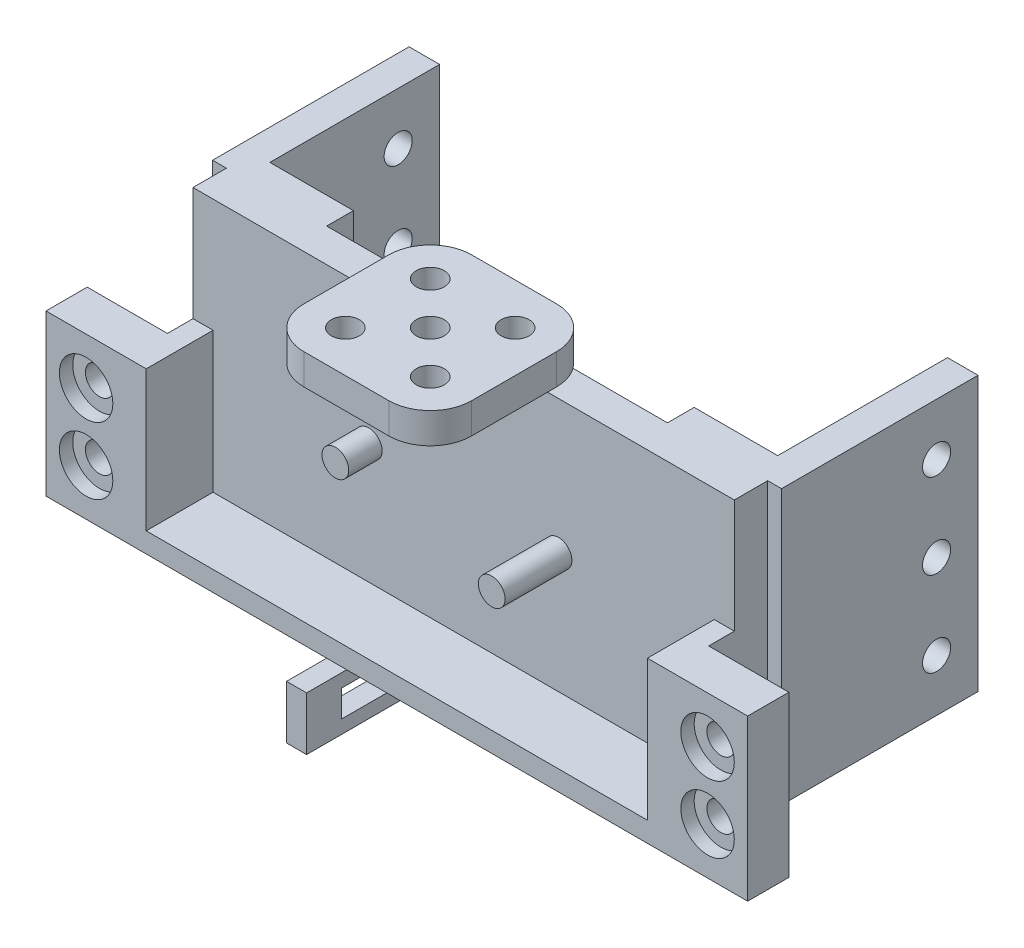
from build123d import *

# Parameters (mm, degrees)
SKETCH1_W                = 75
SKETCH1_H                = 35
BOSS_EXTRUDE1_DEPTH      = 5
SKETCH2_R                = 2
BOSS_EXTRUDE2_DEPTH      = 10
SKETCH3_W                = 75
SKETCH3_H                = 35
BOSS_EXTRUDE3_DEPTH      = 15
CUT_EXTRUDE2_DEPTH       = 10
SKETCH8_W                = 12.55
SKETCH8_H                = 5
SKETCH8_H_2              = 2.55
BOSS_EXTRUDE6_DEPTH      = 4.57
SKETCH9_R                = 2.1
CUT_EXTRUDE3_DEPTH       = 4.57
SKETCH14_W               = 3
SKETCH14_H               = 10
CUT_EXTRUDE5_DEPTH       = 17
SKETCH15_R               = 2.75
CUT_EXTRUDE6_DEPTH       = 1.5
FILLET1_R                = 1
CUT_EXTRUDE7_START       = -5
SKETCH19_R               = 2
CUT_EXTRUDE7_DEPTH       = 5
SKETCH20_W               = 6.17
SKETCH20_H               = 24
BOSS_EXTRUDE7_DEPTH      = 12
SKETCH21_W               = 6.17
SKETCH21_H               = 24
BOSS_EXTRUDE8_DEPTH      = 12
SKETCH24_R               = 2.1
CUT_EXTRUDE8_DEPTH       = 60.774520492
SKETCH25_R               = 4
CUT_EXTRUDE9_DEPTH       = 2
SKETCH26_W               = 3
SKETCH26_H               = 15
SKETCH26_H_2             = 6
BOSS_EXTRUDE9_DEPTH      = 8
SKETCH27_W               = 10.5
SKETCH27_H               = 4
CUT_EXTRUDE10_DEPTH      = 73.730684721
BOSS_EXTRUDE10_DEPTH     = 41
CUT_EXTRUDE11_DEPTH      = 100.332069343
CUT_EXTRUDE11_DEPTH_BACK = 100.332069343
SKETCH30_R               = 2.1
FILLET2_R                = 6.2


with BuildPart() as part:
    # Sketch1 → Boss-Extrude1 (new body)
    with BuildSketch(Plane.XY):
        Rectangle(SKETCH1_W, SKETCH1_H)
    extrude(amount=BOSS_EXTRUDE1_DEPTH)

    # Sketch2 → Boss-Extrude2 (add)
    with BuildSketch(Plane.XY.offset(5)):
        with Locations(Location((-14.2, 0.5, 0), (0, 0, 180))):
            Circle(SKETCH2_R)
        with Locations(Location((14.2, 0.5, 0), (0, 0, 180))):
            Circle(SKETCH2_R)
    extrude(amount=BOSS_EXTRUDE2_DEPTH)

    # Sketch3 → Boss-Extrude3 (add)
    with BuildSketch(Plane(origin=(0, 0, 0), x_dir=(-1, 0, 0), z_dir=(0, 0, -1))):
        Polygon((40.5, 20.5), (-37.5, 20.5), (-40.5, 20.5), (-40.5, -20.5), (40.5, -20.5), (40.5, -17.5), align=None)
        Rectangle(SKETCH3_W, SKETCH3_H, mode=Mode.SUBTRACT)
    extrude(amount=-BOSS_EXTRUDE3_DEPTH)

    # Sketch4 → Cut-Extrude2 (cut)
    with BuildSketch(Plane(origin=(0, 20.5, 0), x_dir=(1, 0, 0), z_dir=(0, 1, 0))):
        Polygon((-37.5, -5), (-37.5, -12.5), (-37.5, -14), (-37.5, -15), (37.5, -15), (37.5, -14), (37.5, -12.5), (37.5, -5), align=None)
    extrude(amount=-CUT_EXTRUDE2_DEPTH, mode=Mode.SUBTRACT)

    # Sketch8 → Boss-Extrude6 (add)
    with BuildSketch(Plane(origin=(0, 20.5, 0), x_dir=(1, 0, 0), z_dir=(0, 1, 0))):
        Polygon((0, -15), (0, -5), (-12.55, -5), (-12.55, -22.55), (0, -22.55), align=None)
        Polygon((12.55, -5), (0, -5), (0, -15), (0, -22.55), (12.55, -22.55), align=None)
        with Locations((-6.275, -2.5)):
            Rectangle(SKETCH8_W, SKETCH8_H)
        with Locations((-6.275, 1.275)):
            Rectangle(SKETCH8_W, SKETCH8_H_2)
        with Locations((6.275, 1.275)):
            Rectangle(SKETCH8_W, SKETCH8_H_2)
        with Locations((6.275, -2.5)):
            Rectangle(SKETCH8_W, SKETCH8_H)
    extrude(amount=BOSS_EXTRUDE6_DEPTH)

    # Sketch9 → Cut-Extrude3 (cut)
    with BuildSketch(Plane(origin=(0, 25.07, 0), x_dir=(1, 0, 0), z_dir=(0, 1, 0))):
        with Locations(Location((0, -10, 0), (0, 0, 270))):
            Circle(SKETCH9_R)
        with Locations(Location((-6.349818895, -3.650181105, 0), (0, 0, 270))):
            Circle(SKETCH9_R)
        with Locations(Location((6.349818895, -3.650181105, 0), (0, 0, 270))):
            Circle(SKETCH9_R)
        with Locations(Location((6.349818895, -16.349818895, 0), (0, 0, 270))):
            Circle(SKETCH9_R)
        with Locations(Location((-6.349818895, -16.349818895, 0), (0, 0, 270))):
            Circle(SKETCH9_R)
    extrude(amount=-CUT_EXTRUDE3_DEPTH, mode=Mode.SUBTRACT)

    # Sketch14 → Cut-Extrude5 (cut)
    with BuildSketch(Plane(origin=(0, 20.5, 0), x_dir=(1, 0, 0), z_dir=(0, 1, 0))):
        with Locations((-39, -10)):
            Rectangle(SKETCH14_W, SKETCH14_H)
        with Locations((39, -10)):
            Rectangle(SKETCH14_W, SKETCH14_H)
    extrude(amount=-CUT_EXTRUDE5_DEPTH, mode=Mode.SUBTRACT)

    # Sketch15 → Cut-Extrude6 (cut)
    with BuildSketch(Plane(origin=(0, 20.5, 0), x_dir=(1, 0, 0), z_dir=(0, 1, 0))):
        with Locations((-6.349818895, -3.650181105)):
            Circle(SKETCH15_R)
        with Locations((6.349818895, -3.650181105)):
            Circle(SKETCH15_R)
    extrude(amount=-CUT_EXTRUDE6_DEPTH, mode=Mode.SUBTRACT)

    # Fillet1
    fillet1_edges = [part.edges().sort_by_distance(p)[0] for p in [
        (-8.745750645, 19.75, 5),
        (-3.953887145, 19.75, 5),
        (3.953887145, 19.75, 5),
        (8.745750645, 19.75, 5),
    ]]
    fillet(fillet1_edges, radius=FILLET1_R)

    # Sketch19 → Cut-Extrude7 (cut)
    with BuildSketch(Plane.XY.offset(15).offset(CUT_EXTRUDE7_START)):
        with Locations(Location((-14.2, 0.5, 0), (0, 0, 180))):
            Circle(SKETCH19_R)
    extrude(amount=CUT_EXTRUDE7_DEPTH, mode=Mode.SUBTRACT)

    # Sketch20 → Boss-Extrude7 (add)
    with BuildSketch(Plane(origin=(40.5, 0, 0), x_dir=(0, 0, -1), z_dir=(1, 0, 0))):
        with Locations((-11.915, -8.5)):
            Rectangle(SKETCH20_W, SKETCH20_H)
    extrude(amount=BOSS_EXTRUDE7_DEPTH)

    # Sketch21 → Boss-Extrude8 (add)
    with BuildSketch(Plane.ZY.offset(40.5)):
        with Locations((11.915, -8.5)):
            Rectangle(SKETCH21_W, SKETCH21_H)
    extrude(amount=BOSS_EXTRUDE8_DEPTH)

    # Sketch24 → Cut-Extrude8 (cut, through all)
    with BuildSketch(Plane(origin=(0, 0, 8.83), x_dir=(-1, 0, 0), z_dir=(0, 0, -1))):
        with Locations(Location((-46.5, -3.5, 0), (0, 0, 90))):
            Circle(SKETCH24_R)
        with Locations(Location((-46.5, -13.5, 0), (0, 0, 90))):
            Circle(SKETCH24_R)
        with Locations(Location((46.5, -3.5, 0), (0, 0, 90))):
            Circle(SKETCH24_R)
        with Locations(Location((46.5, -13.5, 0), (0, 0, 90))):
            Circle(SKETCH24_R)
    extrude(amount=-CUT_EXTRUDE8_DEPTH, mode=Mode.SUBTRACT)

    # Sketch25 → Cut-Extrude9 (cut)
    with BuildSketch(Plane.XY.offset(15)):
        with Locations((-46.5, -3.5)):
            Circle(SKETCH25_R)
        with Locations((-46.5, -13.5)):
            Circle(SKETCH25_R)
        with Locations((46.5, -13.5)):
            Circle(SKETCH25_R)
        with Locations((46.5, -3.5)):
            Circle(SKETCH25_R)
    extrude(amount=-CUT_EXTRUDE9_DEPTH, mode=Mode.SUBTRACT)

    # Sketch26 → Boss-Extrude9 (add)
    with BuildSketch(Plane.XZ.offset(20.5)):
        with Locations((-9, 7.5)):
            Rectangle(SKETCH26_W, SKETCH26_H)
        with Locations((-9, 18)):
            Rectangle(SKETCH26_W, SKETCH26_H_2)
    extrude(amount=BOSS_EXTRUDE9_DEPTH)

    # Sketch27 → Cut-Extrude10 (cut, through all)
    with BuildSketch(Plane.ZY.offset(10.5)):
        with Locations((10.5, -24.5)):
            Rectangle(SKETCH27_W, SKETCH27_H)
    extrude(amount=-CUT_EXTRUDE10_DEPTH, mode=Mode.SUBTRACT)

    # Sketch28 → Boss-Extrude10 (add)
    with BuildSketch(Plane.XZ.offset(20.5)):
        Polygon((-25.5, 0), (-42.57, 0), (-42.57, -29.4), (-38, -29.4), (-38, -4), (-25.5, -4), align=None)
        Polygon((25.5, 0), (42.57, 0), (42.57, -29.4), (38, -29.4), (38, -4), (25.5, -4), align=None)
    extrude(amount=-BOSS_EXTRUDE10_DEPTH)

    # Sketch30 → Cut-Extrude11 (cut, two sides: drawn at the far end of the back side and taken through both)
    with BuildSketch(Plane(origin=(-38, 0, 0), x_dir=(0, 0, -1), z_dir=(1, 0, 0)).offset(-CUT_EXTRUDE11_DEPTH_BACK)):
        with Locations(Location((23.2, 0, 0), (0, 0, 180))):
            Circle(SKETCH30_R)
        with Locations(Location((23.2, 12.7, 0), (0, 0, 180))):
            Circle(SKETCH30_R)
        with Locations(Location((23.2, -12.7, 0), (0, 0, 180))):
            Circle(SKETCH30_R)
    extrude(amount=CUT_EXTRUDE11_DEPTH + CUT_EXTRUDE11_DEPTH_BACK, mode=Mode.SUBTRACT)

    # Fillet2
    # the kernel refuses this fillet: 6.2 mm, written as the material it takes off along each edge
    with BuildSketch(Plane(origin=(12.55, 5, 22.55), x_dir=(0, 0, -1), z_dir=(0, 1, 0))) as fillet2_piece_1:
        with BuildLine():
            CenterArc((FILLET2_R, FILLET2_R), FILLET2_R, 180, 90)
            Line((0, FILLET2_R), (0, 0))
            Line((0, 0), (FILLET2_R, 0))
        make_face()
    extrude(amount=35.57, mode=Mode.SUBTRACT)
    with BuildSketch(Plane(origin=(12.55, 20.5, -2.55), x_dir=(0, 0, 1), z_dir=(0, 1, 0))) as fillet2_piece_2:
        with BuildLine():
            CenterArc((FILLET2_R, -FILLET2_R), FILLET2_R, 90, 90)
            Line((0, -FILLET2_R), (0, 0))
            Line((0, 0), (FILLET2_R, 0))
        make_face()
    extrude(amount=20.07, mode=Mode.SUBTRACT)
    with BuildSketch(Plane(origin=(-12.55, 20.5, -2.55), x_dir=(0, 0, 1), z_dir=(0, 1, 0))) as fillet2_piece_3:
        with BuildLine():
            CenterArc((FILLET2_R, FILLET2_R), FILLET2_R, 180, 90)
            Line((0, FILLET2_R), (0, 0))
            Line((0, 0), (FILLET2_R, 0))
        make_face()
    extrude(amount=20.07, mode=Mode.SUBTRACT)
    with BuildSketch(Plane(origin=(-12.55, 5, 22.55), x_dir=(0, 0, -1), z_dir=(0, 1, 0))) as fillet2_piece_4:
        with BuildLine():
            CenterArc((FILLET2_R, -FILLET2_R), FILLET2_R, 90, 90)
            Line((0, -FILLET2_R), (0, 0))
            Line((0, 0), (FILLET2_R, 0))
        make_face()
    extrude(amount=35.57, mode=Mode.SUBTRACT)


solid = part.part
